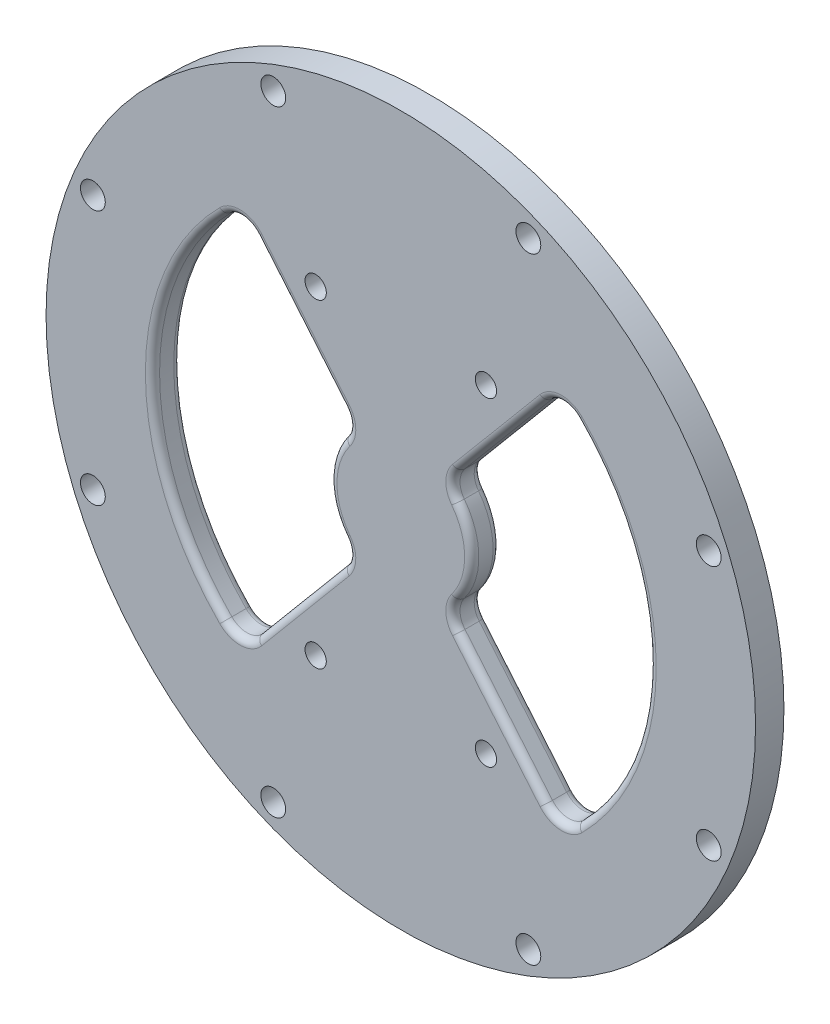
from build123d import *

# Parameters (mm, degrees)
SKETCH_1_R          = 50
EXTRUDE_1_DEPTH     = 4
SKETCH_3_R          = 1.5
CUT_EXTRUDE_1_DEPTH = 4
FILLET_2_R          = 1
SKETCH_2_R          = 1.75
CUT_EXTRUDE_2_DEPTH = 10


with BuildPart() as part:
    # 草图1 → 凸台-拉伸1 (new body)
    with BuildSketch(Plane.XY):
        Circle(SKETCH_1_R)
    extrude(amount=EXTRUDE_1_DEPTH)

    # 草图3 → 切除-拉伸1 (cut)
    with BuildSketch(Plane.XY.offset(4)):
        with Locations((-12, 22.5)):
            Circle(SKETCH_3_R)
        with Locations((-12, -22.5)):
            Circle(SKETCH_3_R)
        with Locations((12, -22.5)):
            Circle(SKETCH_3_R)
        with Locations((12, 22.5)):
            Circle(SKETCH_3_R)
        with BuildLine():
            Line((-8.046125765, 9.80213599), (-20.381764146, 24.503177347))
            ThreePointArc((-20.381764146, 24.503177347), (-22.55251913, 25.572109091), (-24.806137864, 24.691203379))
            ThreePointArc((-24.806137864, 24.691203379), (-35, 0), (-24.806137864, -24.691203379))
            ThreePointArc((-24.806137864, -24.691203379), (-22.55251913, -25.572109091), (-20.381764146, -24.503177347))
            Line((-20.381764146, -24.503177347), (-8.046125765, -9.80213599))
            ThreePointArc((-8.046125765, -9.80213599), (-7.34510579, -7.945043437), (-7.95712238, -6.056748585))
            ThreePointArc((-7.95712238, -6.056748585), (-10, 0), (-7.95712238, 6.056748585))
            ThreePointArc((-7.95712238, 6.056748585), (-7.34510579, 7.945043437), (-8.046125765, 9.80213599))
        make_face()
        with BuildLine():
            Line((8.046125765, -9.80213599), (20.381764146, -24.503177347))
            ThreePointArc((20.381764146, -24.503177347), (22.55251913, -25.572109091), (24.806137864, -24.691203379))
            ThreePointArc((24.806137864, -24.691203379), (35, 0), (24.806137864, 24.691203379))
            ThreePointArc((24.806137864, 24.691203379), (22.55251913, 25.572109091), (20.381764146, 24.503177347))
            Line((20.381764146, 24.503177347), (8.046125765, 9.80213599))
            ThreePointArc((8.046125765, 9.80213599), (7.34510579, 7.945043437), (7.95712238, 6.056748585))
            ThreePointArc((7.95712238, 6.056748585), (10, 0), (7.95712238, -6.056748585))
            ThreePointArc((7.95712238, -6.056748585), (7.34510579, -7.945043437), (8.046125765, -9.80213599))
        make_face()
    extrude(amount=-CUT_EXTRUDE_1_DEPTH, mode=Mode.SUBTRACT)

    # 圆角2
    fillet_2_edges = [part.edges().sort_by_distance(p)[0] for p in [
        (22.55251913, -25.572109091, 0),
        (14.213944956, -17.152656668, 0),
        (7.34510579, -7.945043437, 0),
        (10, 0, 0),
        (7.34510579, 7.945043437, 0),
        (14.213944956, 17.152656668, 0),
        (22.55251913, 25.572109091, 0),
        (22.55251913, -25.572109091, 4),
        (14.213944956, -17.152656668, 4),
        (7.34510579, -7.945043437, 4),
        (10, 0, 4),
        (7.34510579, 7.945043437, 4),
        (14.213944956, 17.152656668, 4),
        (22.55251913, 25.572109091, 4),
        (-7.34510579, 7.945043437, 0),
        (-10, 0, 0),
        (-7.34510579, -7.945043437, 0),
        (-14.213944956, -17.152656668, 0),
        (-22.55251913, -25.572109091, 0),
        (-35, 0, 0),
        (-22.55251913, 25.572109091, 0),
        (-7.34510579, 7.945043437, 4),
        (-10, 0, 4),
        (-7.34510579, -7.945043437, 4),
        (-14.213944956, -17.152656668, 4),
        (-22.55251913, -25.572109091, 4),
        (-35, 0, 4),
        (-22.55251913, 25.572109091, 4),
        (35, 0, 0),
        (35, 0, 4),
        (-14.213944956, 17.152656668, 0),
        (-14.213944956, 17.152656668, 4),
    ]]
    fillet(fillet_2_edges, radius=FILLET_2_R)

    # 草图2 → 切除-拉伸2 (cut)
    with BuildSketch(Plane.XY.offset(4)):
        with Locations((-17.976405999, 43.398883165)):
            Circle(SKETCH_2_R)
        with Locations((17.976405999, 43.398883165)):
            Circle(SKETCH_2_R)
        with Locations((43.398883165, 17.976405999)):
            Circle(SKETCH_2_R)
        with Locations((43.398883165, -17.976405999)):
            Circle(SKETCH_2_R)
        with Locations((17.976405999, -43.398883165)):
            Circle(SKETCH_2_R)
        with Locations((-17.976405999, -43.398883165)):
            Circle(SKETCH_2_R)
        with Locations((-43.398883165, -17.976405999)):
            Circle(SKETCH_2_R)
        with Locations((-43.398883165, 17.976405999)):
            Circle(SKETCH_2_R)
    extrude(amount=-CUT_EXTRUDE_2_DEPTH, mode=Mode.SUBTRACT)


solid = part.part
